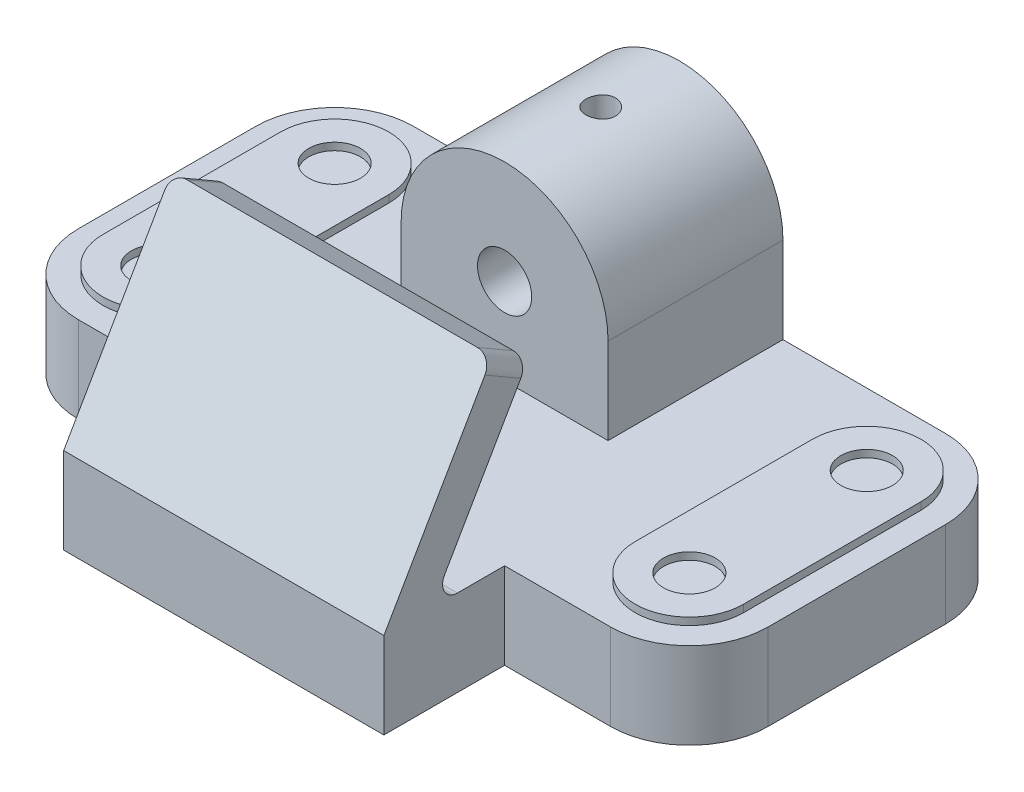
from build123d import *

# Parameters (mm, degrees)
Y_KSEKLIK_EKSTR_ZYON1_DEPTH              = 35
IZIM3_R                                  = 10.5
Y_KSEKLIK_EKSTR_ZYON2_DEPTH              = 3
Y_KSEKLIK_EKSTR_ZYON3_DEPTH              = 71
IZIM5_R                                  = 11
KES_EKSTR_ZYON1_DEPTH                    = 21
IZIM6_R                                  = 6
KES_EKSTR_ZYON2_DEPTH                    = 23
M10_START                                = -68
M10_ALT_GEN_BA_L_C_VATA_IN_HAV_A1_OUTL_R = 22.5
M10_ALT_GEN_BA_L_C_VATA_IN_HAV_A1_DEPTH  = 50
IZIM9_W                                  = 130
IZIM9_H                                  = 35
Y_KSEKLIK_EKSTR_ZYON4_DEPTH              = 49
Y_KSEKLIK_EKSTR_ZYON5_DEPTH              = 130
RADYUS1_R                                = 6
RADYUS2_R                                = 6


# Read off the part's stored shape, not the designer's step: M10 Altıgen Başlı Cıvata İçin Havşa1
with BuildPart() as part:
    # Çizim1 → Yükseklik-Ekstrüzyon1 (new body)
    with BuildSketch(Plane(origin=(0, 0, 0), x_dir=(1, 0, 0), z_dir=(0, 1, 0))):
        with BuildLine():
            Line((-108, 68), (108, 68))
            ThreePointArc((108, 68), (130.627416998, 58.627416998), (140, 36))
            Line((140, 36), (140, -36))
            ThreePointArc((140, -36), (130.627416998, -58.627416998), (108, -68))
            Line((108, -68), (-108, -68))
            ThreePointArc((-108, -68), (-130.627416998, -58.627416998), (-140, -36))
            Line((-140, -36), (-140, 36))
            ThreePointArc((-140, 36), (-130.627416998, 58.627416998), (-108, 68))
        make_face()
    extrude(amount=Y_KSEKLIK_EKSTR_ZYON1_DEPTH)

    # Çizim3 → Yükseklik-Ekstrüzyon2 (add)
    # profile 1 of 2: a face of its own
    with BuildSketch(Plane(origin=(0, 35, 0), x_dir=(1, 0, 0), z_dir=(0, 1, 0))):
        with BuildLine():
            Line((-130, -36), (-130, 36))
            ThreePointArc((-130, 36), (-108, 58), (-86, 36))
            Line((-86, 36), (-86, -36))
            ThreePointArc((-86, -36), (-108, -58), (-130, -36))
        make_face()
        with Locations(Location((-108, 36, 0), (0, 0, 270))):
            Circle(IZIM3_R, mode=Mode.SUBTRACT)
        with Locations(Location((-108, -36, 0), (0, 0, 270))):
            Circle(IZIM3_R, mode=Mode.SUBTRACT)
    # profile 2 of 2: a face of its own
    with BuildSketch(Plane(origin=(0, 35, 0), x_dir=(1, 0, 0), z_dir=(0, 1, 0))):
        with BuildLine():
            Line((130, -36), (130, 36))
            ThreePointArc((130, 36), (108, 58), (86, 36))
            Line((86, 36), (86, -36))
            ThreePointArc((86, -36), (108, -58), (130, -36))
        make_face()
        with Locations(Location((108, -36, 0), (0, 0, 90))):
            Circle(IZIM3_R, mode=Mode.SUBTRACT)
        with Locations(Location((108, 36, 0), (0, 0, 90))):
            Circle(IZIM3_R, mode=Mode.SUBTRACT)
    extrude(amount=Y_KSEKLIK_EKSTR_ZYON2_DEPTH)

    # Çizim4 → Yükseklik-Ekstrüzyon3 (add)
    with BuildSketch(Plane(origin=(0, 0, -68), x_dir=(-1, 0, 0), z_dir=(0, 0, -1))):
        with BuildLine():
            Line((-42, 70), (-42, 35))
            Line((-42, 35), (42, 35))
            Line((42, 35), (42, 70))
            ThreePointArc((42, 70), (0, 112), (-42, 70))
        make_face()
    extrude(amount=-Y_KSEKLIK_EKSTR_ZYON3_DEPTH)

    # Çizim5 → Kes-Ekstrüzyon1 (cut)
    with BuildSketch(Plane.XY.offset(3)):
        with Locations((0, 70)):
            Circle(IZIM5_R)
    extrude(amount=-KES_EKSTR_ZYON1_DEPTH, mode=Mode.SUBTRACT)

    # Çizim6 → Kes-Ekstrüzyon2 (cut)
    with BuildSketch(Plane(origin=(0, 112, 0), x_dir=(1, 0, 0), z_dir=(0, 1, 0))):
        with Locations(Location((0, 36, 0), (0, 0, 270))):
            Circle(IZIM6_R)
    extrude(amount=-KES_EKSTR_ZYON2_DEPTH, mode=Mode.SUBTRACT)

    # M10 Altıgen Başlı Cıvata İçin Havşa1 outl → M10 Altıgen Başlı Cıvata İçin Havşa1 (cut)
    with BuildSketch(Plane.XY.offset(M10_START)):
        with Locations((0, 70)):
            Circle(M10_ALT_GEN_BA_L_C_VATA_IN_HAV_A1_OUTL_R)
    extrude(amount=M10_ALT_GEN_BA_L_C_VATA_IN_HAV_A1_DEPTH, mode=Mode.SUBTRACT)

    # Çizim9 → Yükseklik-Ekstrüzyon4 (add)
    with BuildSketch(Plane.XY.offset(68)):
        with Locations((0, 17.5)):
            Rectangle(IZIM9_W, IZIM9_H)
    extrude(amount=Y_KSEKLIK_EKSTR_ZYON4_DEPTH)

    # Çizim10 → Yükseklik-Ekstrüzyon5 (add)
    with BuildSketch(Plane(origin=(65, 0, 0), x_dir=(0, 0, -1), z_dir=(1, 0, 0))):
        Polygon((-117, 35), (-72.990557656, 111.226590152), (-58.413699339, 102.810637079), (-97.564188911, 35), align=None)
    extrude(amount=-Y_KSEKLIK_EKSTR_ZYON5_DEPTH)

    # Radyus1
    radyus1_edges = [part.edges().sort_by_distance(p)[0] for p in [
        (-65, 107.018613616, 65.702128498),
        (65, 107.018613616, 65.702128498),
    ]]
    fillet(radyus1_edges, radius=RADYUS1_R)

    # Radyus2
    radyus2_edges = [part.edges().sort_by_distance(p)[0] for p in [
        (0, 35, 97.564188911),
    ]]
    fillet(radyus2_edges, radius=RADYUS2_R)


solid = part.part
